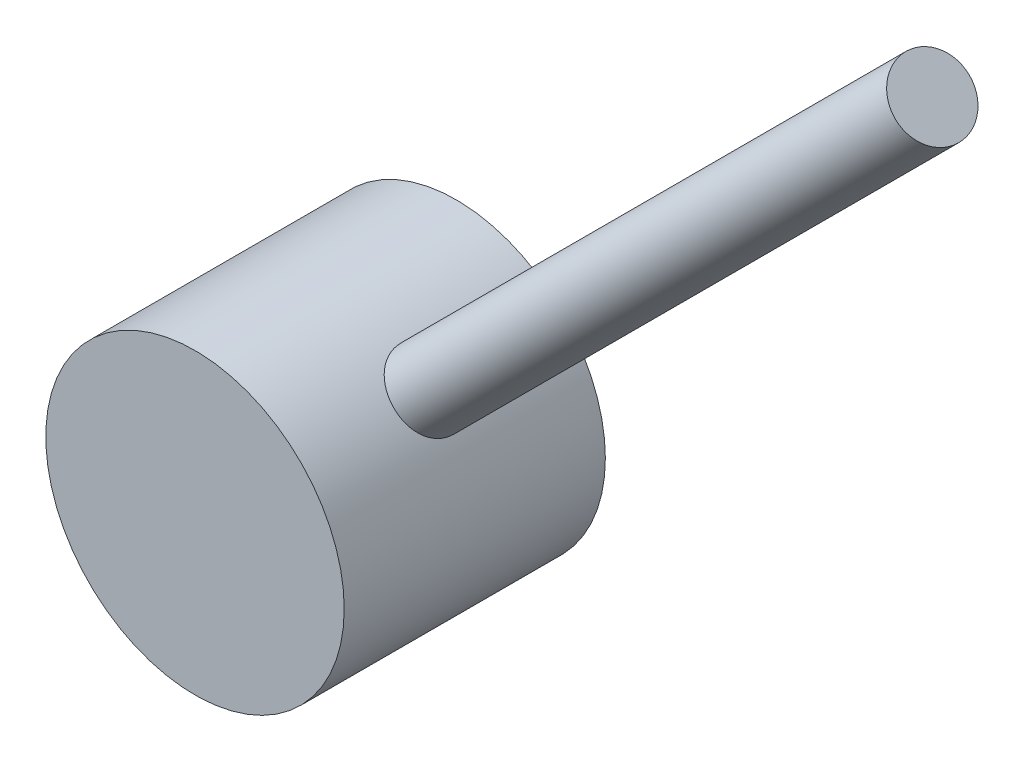
from build123d import *

# Parameters (mm, degrees)
CYLINDER_ON_WIRE_END_DEPTH      = 4.5
CYLINDER_ON_WIRE_END_DEPTH_BACK = 2.5
SKETCH1_R                       = 4
SKETCH4_R                       = 1
WIRE_2_DEPTH                    = 25


with BuildPart() as part:
    # Sketch1 → Cylinder on Wire end (new, two sides: drawn at the far end of the back side and taken through both)
    with BuildSketch(Plane.XY.offset(-CYLINDER_ON_WIRE_END_DEPTH_BACK)):
        Circle(SKETCH1_R)
    extrude(amount=CYLINDER_ON_WIRE_END_DEPTH + CYLINDER_ON_WIRE_END_DEPTH_BACK)

    # Sketch4 → Wire 2 (add)
    with BuildSketch(Plane(origin=(-1.414213562, -1.414213562, 0), x_dir=(0.7071067811865464, -0.7071067811865488, 0), z_dir=(0.7071067811865488, 0.7071067811865464, 0))):
        with Locations((0, -1)):
            Circle(SKETCH4_R)
    extrude(amount=WIRE_2_DEPTH)


solid = part.part
